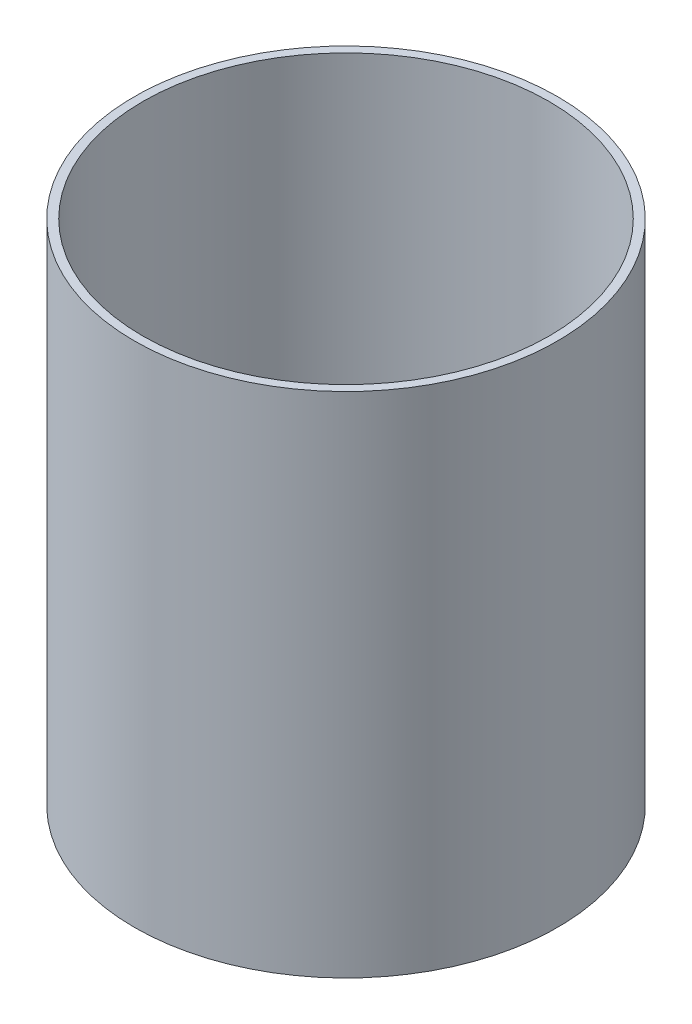
from build123d import *

# Parameters (mm, degrees)
SKETCH1_R           = 1250
SKETCH1_R_2         = 1200.000000046
BOSS_EXTRUDE1_DEPTH = 3000


with BuildPart() as part:
    # Sketch1 → Boss-Extrude1 (new body)
    with BuildSketch(Plane(origin=(0, 0, 0), x_dir=(1, 0, 0), z_dir=(0, 1, 0))):
        Circle(SKETCH1_R)
        Circle(SKETCH1_R_2, mode=Mode.SUBTRACT)
    extrude(amount=BOSS_EXTRUDE1_DEPTH)


solid = part.part
